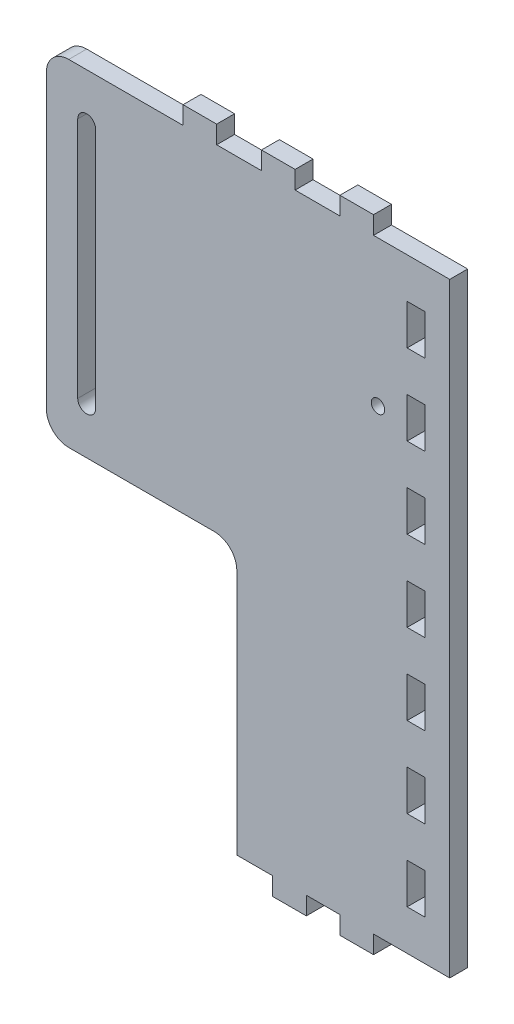
from build123d import *

# Parameters (mm, degrees)
SKETCH1_R           = 3
BOSS_EXTRUDE1_DEPTH = 8
SKETCH2_W           = 8
SKETCH2_H           = 18
CUT_EXTRUDE1_DEPTH  = 163.446914406
SKETCH3_W           = 15
SKETCH3_H           = 8
BOSS_EXTRUDE2_DEPTH = 8
SKETCH4_W           = 15
SKETCH4_H           = 8
BOSS_EXTRUDE3_DEPTH = 8


with BuildPart() as part:
    # Sketch1 → Boss-Extrude1 (new body)
    with BuildSketch(Plane.XY):
        with BuildLine():
            Line((90, 135), (-80, 135))
            ThreePointArc((-80, 135), (-87.071067812, 132.071067812), (-90, 125))
            Line((-90, 125), (-90, -5))
            ThreePointArc((-90, -5), (-87.071067812, -12.071067812), (-80, -15))
            Line((-80, -15), (-15, -15))
            ThreePointArc((-15, -15), (-7.928932188, -17.928932188), (-5, -25))
            Line((-5, -25), (-5, -135))
            Line((-5, -135), (90, -135))
            Line((90, -135), (90, 135))
        make_face()
        with Locations((58, 70)):
            Circle(SKETCH1_R, mode=Mode.SUBTRACT)
        with BuildLine():
            Line((-68, 114), (-68, 6))
            ThreePointArc((-68, 6), (-72, 2), (-76, 6))
            Line((-76, 6), (-76, 114))
            ThreePointArc((-76, 114), (-72, 118), (-68, 114))
        make_face(mode=Mode.SUBTRACT)
    extrude(amount=BOSS_EXTRUDE1_DEPTH)

    # Sketch2 → Cut-Extrude1 (cut, through all)
    with BuildSketch(Plane.XY.offset(8)):
        with Locations((75, -108)):
            Rectangle(SKETCH2_W, SKETCH2_H)
        with Locations((75, -72)):
            Rectangle(SKETCH2_W, SKETCH2_H)
        with Locations((75, -36)):
            Rectangle(SKETCH2_W, SKETCH2_H)
        with Locations((75, 0)):
            Rectangle(SKETCH2_W, SKETCH2_H)
        with Locations((75, 36)):
            Rectangle(SKETCH2_W, SKETCH2_H)
        with Locations((75, 72)):
            Rectangle(SKETCH2_W, SKETCH2_H)
        with Locations((75, 108)):
            Rectangle(SKETCH2_W, SKETCH2_H)
    extrude(amount=-CUT_EXTRUDE1_DEPTH, mode=Mode.SUBTRACT)

    # Sketch3 → Boss-Extrude2 (add)
    with BuildSketch(Plane.XZ.offset(135)):
        with Locations((48.5, 4)):
            Rectangle(SKETCH3_W, SKETCH3_H)
        with Locations((18.5, 4)):
            Rectangle(SKETCH3_W, SKETCH3_H)
    extrude(amount=BOSS_EXTRUDE2_DEPTH)

    # Sketch4 → Boss-Extrude3 (add)
    with BuildSketch(Plane(origin=(0, 135, 0), x_dir=(1, 0, 0), z_dir=(0, 1, 0))):
        with Locations((48.5, -4)):
            Rectangle(SKETCH4_W, SKETCH4_H)
        with Locations((13.5, -4)):
            Rectangle(SKETCH4_W, SKETCH4_H)
        with Locations((-21.5, -4)):
            Rectangle(SKETCH4_W, SKETCH4_H)
    extrude(amount=BOSS_EXTRUDE3_DEPTH)


solid = part.part
